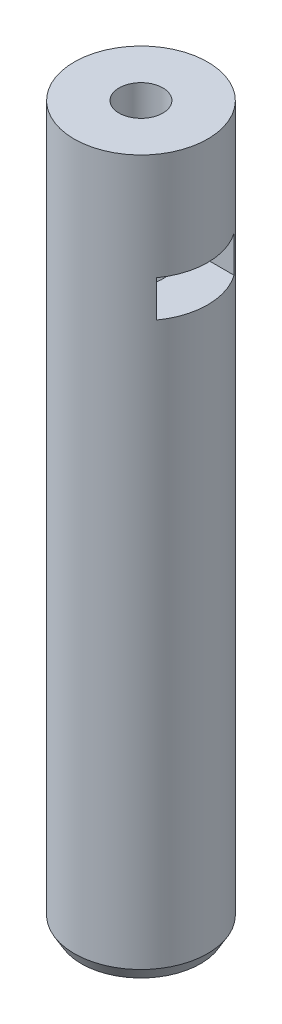
from build123d import *

# Parameters (mm, degrees)
SKETCH2_R           = 9.3
BOSS_EXTRUDE1_DEPTH = 100
CHAMFER1_SIZE       = 1
CHAMFER1_SIZE2      = 1.732050808
SKETCH3_R           = 3.05
CUT_EXTRUDE1_DEPTH  = 25
CUT_EXTRUDE2_DEPTH  = 5.1


with BuildPart() as part:
    # Sketch2 → Boss-Extrude1 (new body)
    with BuildSketch(Plane(origin=(0, 0, 0), x_dir=(1, 0, 0), z_dir=(0, 1, 0))):
        Circle(SKETCH2_R)
    extrude(amount=BOSS_EXTRUDE1_DEPTH)

    # Chamfer1
    chamfer1_edges = [part.edges().sort_by_distance(p)[0] for p in [
        (-9.3, 0, 0),
    ]]
    chamfer1_side = [part.faces().sort_by_distance(p)[0] for p in [
        (0, 0, 0),
    ]]
    chamfer(chamfer1_edges, length=CHAMFER1_SIZE, length2=CHAMFER1_SIZE2, reference=chamfer1_side[0])

    # Sketch3 → Cut-Extrude1 (cut)
    with BuildSketch(Plane(origin=(0, 100, 0), x_dir=(1, 0, 0), z_dir=(0, 1, 0))):
        Circle(SKETCH3_R)
    extrude(amount=-CUT_EXTRUDE1_DEPTH, mode=Mode.SUBTRACT)

    # Sketch4 → Cut-Extrude2 (cut)
    with BuildSketch(Plane(origin=(0, 80, 0), x_dir=(1, 0, 0), z_dir=(0, 1, 0))):
        with BuildLine():
            Line((3.12, 5.40399852), (7.568804397, 5.40399852))
            ThreePointArc((7.568804397, 5.40399852), (9.3, 0), (7.568804397, -5.40399852))
            Line((7.568804397, -5.40399852), (3.12, -5.40399852))
            Line((3.12, -5.40399852), (-3.12, -5.40399852))
            Line((-3.12, -5.40399852), (-6.24, 0))
            Line((-6.24, 0), (-3.12, 5.40399852))
            Line((-3.12, 5.40399852), (3.12, 5.40399852))
        make_face()
    extrude(amount=CUT_EXTRUDE2_DEPTH, mode=Mode.SUBTRACT)


solid = part.part
